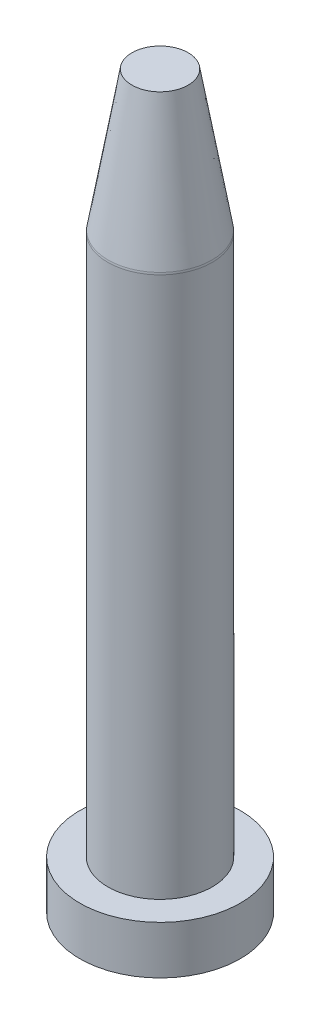
from build123d import *

# Parameters (mm, degrees)
FILLET_1_R = 3


with BuildPart() as part:
    # 草图1 → Revolve 292 (revolve)
    with BuildSketch(Plane.XY):
        Polygon((0, 0), (20, 0), (20, 12), (13, 12), (13, 147), (7, 182), (0, 182), align=None)
    revolve(axis=Axis((0, 0, 0), (0, 1, 0)))

    # 圆角1
    fillet_1_edges = [part.edges().sort_by_distance(p)[0] for p in [
        (-13, 147, 0),
    ]]
    fillet(fillet_1_edges, radius=FILLET_1_R)


solid = part.part
